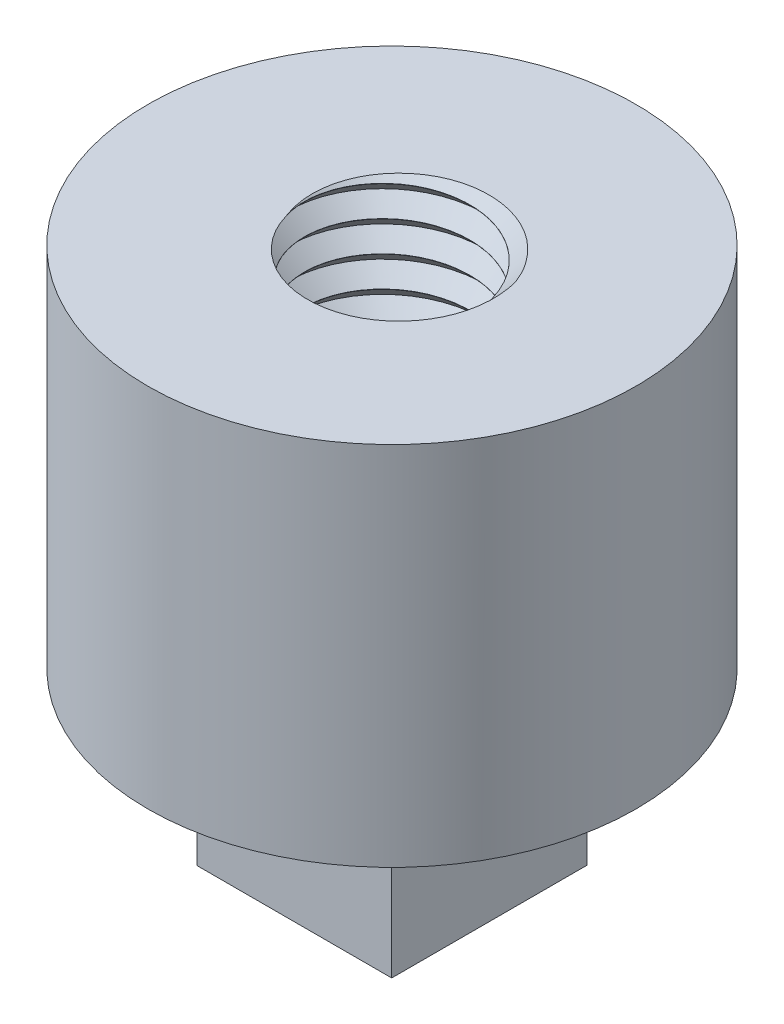
from build123d import *

# Parameters (mm, degrees)
SKETCH_1_W          = 6.6
SKETCH_1_H          = 11
SWEEP_1_PITCH       = 1.25
BOSS_EXTRUDE2_START = 0.82
SKETCH9_R           = 10
BOSS_EXTRUDE2_DEPTH = 0.82
SKETCH_5_W          = 7.979374496
SKETCH_5_H          = 8
EXTRUDE_1_DEPTH     = 7


with BuildPart() as part:
    # 草图1 → 旋转1 (revolve)
    with BuildSketch(Plane.XY, mode=Mode.PRIVATE) as revolve_1_sk:
        with Locations((6.7, -5.5)):
            Rectangle(SKETCH_1_W, SKETCH_1_H)
    revolve(revolve_1_sk.sketch.rotate(Axis((0, 16.878026906, 0), (0, -1, 0)), 90), axis=Axis((0, 16.878026906, 0), (0, -1, 0)))

    # 切除-扫描1: arcs per turn and ends read off the stored shape
    # 切除-扫描1: the profile of 草图3 profile screwed along a right-hand helix through 11.25 turns, 8 arcs to a turn; built about Z, then put on its axis
    sweep_1_z = Axis((0, 0, 0), (0, 0, 1))
    sweep_1_corners = [(3.3997, 0, -1.8702976), (3.3997, 0, -0.6297024), (4.025, 0, -1.25)]
    with BuildLine(mode=Mode.PRIVATE) as sweep_1_profile:
        Line(sweep_1_corners[0], sweep_1_corners[1])
        Line(sweep_1_corners[1], sweep_1_corners[2])
        Line(sweep_1_corners[2], sweep_1_corners[0])
    sweep_1_cap = Face(sweep_1_profile.wire())
    sweep_1_turn_angles = [0, 22.5, 45, 67.5, 90, 112.5, 135, 157.5, 180, 202.5, 225, 247.5, 270, 292.5, 315, 337.5, 360]
    sweep_1_turn_weights = [1, 0.9238795325112867, 1, 0.9238795325112867, 1, 0.9238795325112867, 1, 0.9238795325112867, 1, 0.9238795325112867, 1, 0.9238795325112867, 1, 0.9238795325112867, 1, 0.9238795325112867, 1]
    sweep_1_turn_rails = [Edge.make_bspline([Vector(p[0], p[1], 0).rotate(sweep_1_z, sweep_1_turn_angles[k]) / sweep_1_turn_weights[k] + Vector(0, 0, p[2] + SWEEP_1_PITCH * sweep_1_turn_angles[k] / 360) for k in range(17)], [0, 0, 0, 1, 1, 2, 2, 3, 3, 4, 4, 5, 5, 6, 6, 7, 7, 8, 8, 8], 2, sweep_1_turn_weights) for p in sweep_1_corners]
    sweep_1_turn_sides = [Face.make_surface_from_curves(sweep_1_turn_rails[p[0]], sweep_1_turn_rails[p[1]]) for p in [(0, 1), (1, 2), (2, 0)]]
    sweep_1_last_angles = [3960, 3982.5, 4005, 4027.5, 4050]
    sweep_1_last_weights = [1, 0.9238795325112867, 1, 0.9238795325112867, 1]
    sweep_1_last_rails = [Edge.make_bspline([Vector(p[0], p[1], 0).rotate(sweep_1_z, sweep_1_last_angles[k]) / sweep_1_last_weights[k] + Vector(0, 0, p[2] + SWEEP_1_PITCH * sweep_1_last_angles[k] / 360) for k in range(5)], [0, 0, 0, 1, 1, 2, 2, 2], 2, sweep_1_last_weights) for p in sweep_1_corners]
    sweep_1_last_sides = [Face.make_surface_from_curves(sweep_1_last_rails[p[0]], sweep_1_last_rails[p[1]]) for p in [(0, 1), (1, 2), (2, 0)]]
    sweep_1 = Plane(origin=(0, -11, 0), x_dir=(0, 0, -1), z_dir=(0, 1, 0)) * Solid(Shell([*[p.moved(Location((0, 0, SWEEP_1_PITCH * i))) for i in range(11) for p in sweep_1_turn_sides], *sweep_1_last_sides, sweep_1_cap, sweep_1_cap.rotate(sweep_1_z, 4050).moved(Location((0, 0, SWEEP_1_PITCH * 4050 / 360)))]))
    add(sweep_1, mode=Mode.SUBTRACT)

    # 草图4 → 旋转2 (revolve)
    with BuildSketch(Plane.XY, mode=Mode.PRIVATE) as revolve_2_sk:
        Polygon((0, -13.323834833), (4.025, -11), (10, -11), (10, -14.182082338), (0, -14.182082338), align=None)
    revolve(revolve_2_sk.sketch.rotate(Axis((0, 0, 0), (0, -1, 0)), 90), axis=Axis((0, 0, 0), (0, -1, 0)))

    # Sketch9 → Boss-Extrude2 (add)
    with BuildSketch(Plane.XZ.offset(14.182082338).offset(BOSS_EXTRUDE2_START)):
        with Locations(Location((0, 0, 0), (0, 0, 90))):
            Circle(SKETCH9_R)
    extrude(amount=-BOSS_EXTRUDE2_DEPTH)

    # 草图5 → 凸台-拉伸1 (add)
    with BuildSketch(Plane.XZ.offset(15.002082338)):
        Rectangle(SKETCH_5_W, SKETCH_5_H)
    extrude(amount=EXTRUDE_1_DEPTH)


solid = part.part
